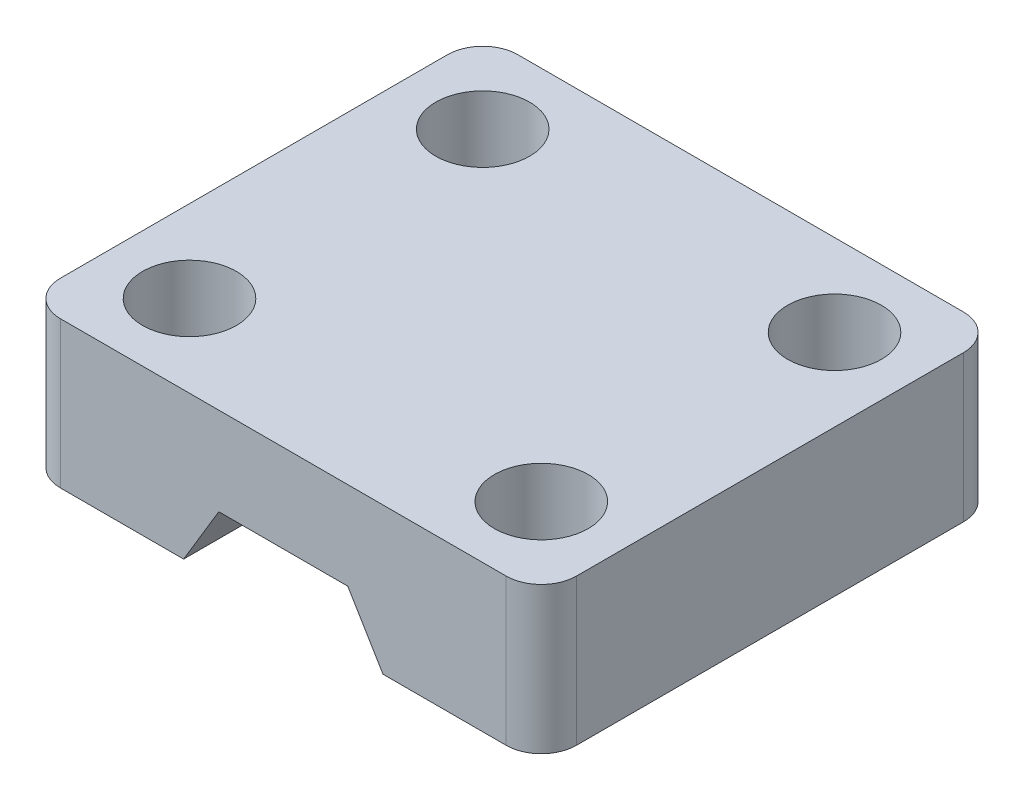
from build123d import *

# Parameters (mm, degrees)
BOSS_EXTRUDE1_DEPTH = 39
SKETCH2_R           = 4
CUT_EXTRUDE1_DEPTH  = 61.110315255
FILLET1_R           = 3


with BuildPart() as part:
    # Sketch1 → Boss-Extrude1 (new body)
    with BuildSketch(Plane.XY):
        Polygon((13.5, -12.5), (16.5, -7.5), (27.5, -7.5), (30.5, -12.5), (44, -12.5), (44, 0), (0, 0), (0, -12.5), align=None)
    extrude(amount=BOSS_EXTRUDE1_DEPTH)

    # Sketch2 → Cut-Extrude1 (cut, through all)
    with BuildSketch(Plane(origin=(0, 0, 0), x_dir=(1, 0, 0), z_dir=(0, 1, 0))):
        with Locations((7, -7)):
            Circle(SKETCH2_R)
        with Locations((37, -7)):
            Circle(SKETCH2_R)
        with Locations((37, -32)):
            Circle(SKETCH2_R)
        with Locations((7, -32)):
            Circle(SKETCH2_R)
    extrude(amount=-CUT_EXTRUDE1_DEPTH, mode=Mode.SUBTRACT)

    # Fillet1
    fillet1_edges = [part.edges().sort_by_distance(p)[0] for p in [
        (0, -6.25, 0),
        (44, -6.25, 0),
        (44, -6.25, 39),
        (0, -6.25, 39),
    ]]
    fillet(fillet1_edges, radius=FILLET1_R)


solid = part.part
